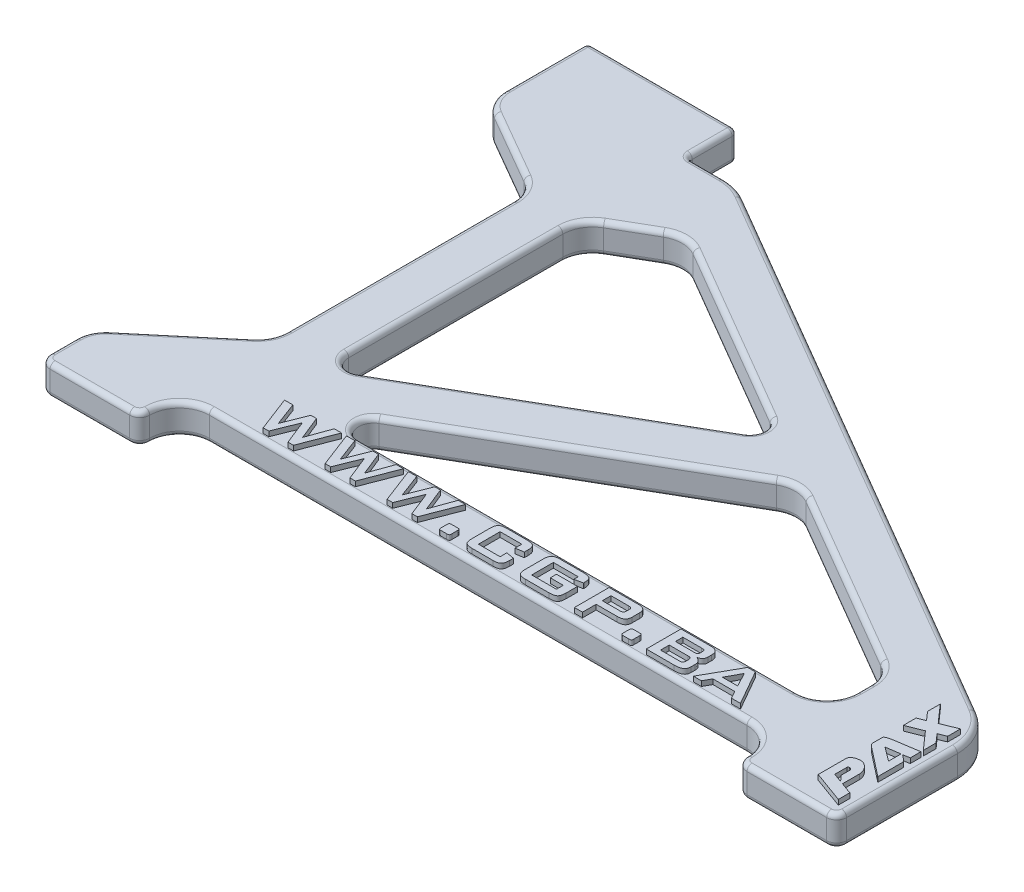
from build123d import *

# Parameters (mm, degrees)
BOSS_EXTRUDE1_DEPTH = 3
CUT_EXTRUDE1_DEPTH  = 3
FILLET1_R           = 3
FILLET2_R           = 1
FILLET3_R           = 5
BOSS_EXTRUDE2_DEPTH = 0.5
FILLET4_R           = 0.5


with BuildPart() as part:
    # Sketch1 → Boss-Extrude1 (new body)
    with BuildSketch(Plane(origin=(0, 0, 0), x_dir=(1, 0, 0), z_dir=(0, 1, 0))):
        Polygon((0, 0), (0, 5), (15, 5), (15, 0), (20, 0), (80, -35), (80, -50), (0, -50), align=None)
    extrude(amount=BOSS_EXTRUDE1_DEPTH)

    # Sketch2 → Cut-Extrude1 (cut)
    with BuildSketch(Plane(origin=(0, 3, 0), x_dir=(1, 0, 0), z_dir=(0, 1, 0))):
        with BuildLine():
            Line((0, -5), (8.5, -9.907477288))
            ThreePointArc((8.5, -9.907477288), (9.598076211, -11.005553499), (10, -12.505553499))
            Line((10, -12.505553499), (10, -35.210080714))
            ThreePointArc((10, -35.210080714), (9.718923361, -36.477935499), (8.928362829, -37.508214043))
            Line((8.928362829, -37.508214043), (0, -45))
            Line((0, -45), (0, -5))
        make_face()
        with BuildLine():
            Line((13, -46), (67, -46))
            ThreePointArc((67, -46), (69.121320344, -46.878679656), (70, -49))
            Line((70, -49), (70, -54))
            Line((70, -54), (10, -54))
            Line((10, -54), (10, -49))
            ThreePointArc((10, -49), (10.878679656, -46.878679656), (13, -46))
        make_face()
        with BuildLine():
            Line((15, -12.505553499), (15, -34.010927477))
            ThreePointArc((15, -34.010927477), (15.75, -35.309965583), (17.25, -35.309965583))
            Line((17.25, -35.309965583), (41.828205683, -21.119731915))
            ThreePointArc((41.828205683, -21.119731915), (42.578201927, -19.824050561), (41.834012221, -18.525025458))
            Line((41.834012221, -18.525025458), (23.311607175, -7.720289181))
            ThreePointArc((23.311607175, -7.720289181), (21.806707602, -7.311633396), (20.299994099, -7.713549672))
            Line((20.299994099, -7.713549672), (16.5, -9.907477288))
            ThreePointArc((16.5, -9.907477288), (15.401923789, -11.005553499), (15, -12.505553499))
        make_face()
        with BuildLine():
            Line((22.242647504, -38.200961894), (47.533086407, -23.599520186))
            ThreePointArc((47.533086407, -23.599520186), (49.03979991, -23.197603909), (50.544699483, -23.606259694))
            Line((50.544699483, -23.606259694), (68.511613077, -34.08695929))
            ThreePointArc((68.511613077, -34.08695929), (69.601426458, -35.184113814), (70, -36.678295993))
            Line((70, -36.678295993), (70, -38))
            ThreePointArc((70, -38), (69.121320344, -40.121320344), (67, -41))
            Line((67, -41), (22.992647504, -41))
            ThreePointArc((22.992647504, -41), (21.543758764, -39.888228568), (22.242647504, -38.200961894))
        make_face()
    extrude(amount=-CUT_EXTRUDE1_DEPTH, mode=Mode.SUBTRACT)

    # Fillet1
    fillet1_edges = [part.edges().sort_by_distance(p)[0] for p in [
        (0, 1.5, 45),
        (0, 1.5, 5),
    ]]
    fillet(fillet1_edges, radius=FILLET1_R)

    # Fillet2
    fillet2_edges = [part.edges().sort_by_distance(p)[0] for p in [
        (80, 1.5, 50),
        (70, 1.5, 50),
        (10, 1.5, 50),
        (0, 1.5, 50),
    ]]
    fillet(fillet2_edges, radius=FILLET2_R - 0.0001)  # a hair under: the kernel refuses the full size

    # Fillet3
    fillet3_edges = [part.edges().sort_by_distance(p)[0] for p in [
        (20, 1.5, 0),
        (80, 1.5, 35),
    ]]
    fillet(fillet3_edges, radius=FILLET3_R)

    # Sketch3 → Boss-Extrude2 (add)
    # profile 1 of 13: a face of its own
    with BuildSketch(Plane(origin=(0, 3, 0), x_dir=(1, 0, 0), z_dir=(0, 1, 0))):
        Polygon((17.794950809, -45.392304805), (16.45331297, -41.90793523), (17.290378318, -41.90793523), (18.173137127, -44.245107233), (19.099644997, -41.90793523), (19.666438373, -41.90793523), (20.608501464, -44.245107233), (21.452372221, -41.90793523), (22.177634415, -41.90793523), (20.833079972, -45.392304805), (20.285730622, -45.392304805), (19.327140108, -42.982217702), (18.354938776, -45.392304805), align=None)
    # profile 2 of 13: a face of its own
    with BuildSketch(Plane(origin=(0, 3, 0), x_dir=(1, 0, 0), z_dir=(0, 1, 0))):
        Polygon((24.017039335, -45.392304805), (22.675401497, -41.90793523), (23.512466844, -41.90793523), (24.395225653, -44.245107233), (25.321733523, -41.90793523), (25.8885269, -41.90793523), (26.830589991, -44.245107233), (27.674460747, -41.90793523), (28.399722941, -41.90793523), (27.055168498, -45.392304805), (26.507819148, -45.392304805), (25.549228635, -42.982217702), (24.577027302, -45.392304805), align=None)
    # profile 3 of 13: a face of its own
    with BuildSketch(Plane(origin=(0, 3, 0), x_dir=(1, 0, 0), z_dir=(0, 1, 0))):
        Polygon((30.239127861, -45.392304805), (28.897490023, -41.90793523), (29.73455537, -41.90793523), (30.617314179, -44.245107233), (31.543822049, -41.90793523), (32.110615426, -41.90793523), (33.052678517, -44.245107233), (33.896549273, -41.90793523), (34.621811467, -41.90793523), (33.277257024, -45.392304805), (32.729907674, -45.392304805), (31.771317161, -42.982217702), (30.799115829, -45.392304805), align=None)
    # profile 4 of 13: a face of its own
    with BuildSketch(Plane(origin=(0, 3, 0), x_dir=(1, 0, 0), z_dir=(0, 1, 0))):
        with BuildLine():
            Line((36.201638632, -44.334549755), (36.325108201, -44.334549755))
            add(Edge.make_bspline(
                [(36.325108201, -44.334549755), (36.339103933, -44.334941983), (36.365231193, -44.335674195), (36.401371267, -44.345308875), (36.430560402, -44.362161152), (36.453966334, -44.386467541), (36.470254064, -44.420348106), (36.481630515, -44.464810691), (36.487706617, -44.520723439), (36.488181059, -44.562032059), (36.488438025, -44.584405498)],
                knots=[0, 0, 0, 0, 0.968398765, 1.807808654, 2.563023631, 3.278073111, 4.112053774, 5.136674271, 6.449174888, 8, 8, 8, 8], degree=3))
            Line((36.488438025, -44.584405498), (36.488438025, -45.138560257))
            add(Edge.make_bspline(
                [(36.488438025, -45.138560257), (36.487755868, -45.162860801), (36.486515696, -45.2070396), (36.480957701, -45.266754218), (36.468887451, -45.312157766), (36.450764023, -45.348293594), (36.413794532, -45.370654765), (36.360887936, -45.382921035), (36.288408836, -45.391222369), (36.233425802, -45.39191604), (36.202610833, -45.392304805)],
                knots=[0, 0, 0, 0, 1.245223412, 2.263837154, 3.05685317, 3.651542874, 4.272716292, 5.186506804, 6.423191693, 8, 8, 8, 8], degree=3))
            Line((36.202610833, -45.392304805), (35.594012799, -45.392304805))
            add(Edge.make_bspline(
                [(35.594012799, -45.392304805), (35.57996679, -45.392059538), (35.553654442, -45.391600081), (35.517775299, -45.380023379), (35.487406835, -45.364115094), (35.464101986, -45.338448208), (35.449179882, -45.303283507), (35.437485633, -45.258497796), (35.431427214, -45.202232122), (35.430944449, -45.160930115), (35.430682975, -45.138560257)],
                knots=[0, 0, 0, 0, 0.959514596, 1.797456011, 2.565028956, 3.289768007, 4.126229744, 5.162942654, 6.463402284, 8, 8, 8, 8], degree=3))
            Line((35.430682975, -45.138560257), (35.430682975, -44.584405498))
            add(Edge.make_bspline(
                [(35.430682975, -44.584405498), (35.431380936, -44.560755857), (35.432655968, -44.517552819), (35.438087575, -44.459089719), (35.450425573, -44.414425324), (35.468345143, -44.378557163), (35.505331382, -44.356201374), (35.558230964, -44.34393285), (35.630712943, -44.335632441), (35.685695478, -44.33493861), (35.716510167, -44.334549755)],
                knots=[0, 0, 0, 0, 1.222089808, 2.232507098, 3.015994737, 3.615599952, 4.241907786, 5.163251391, 6.410158312, 8, 8, 8, 8], degree=3))
            Line((35.716510167, -44.334549755), (36.201638632, -44.334549755))
        make_face()
    # profile 5 of 13: a face of its own
    with BuildSketch(Plane(origin=(0, 3, 0), x_dir=(1, 0, 0), z_dir=(0, 1, 0))):
        with BuildLine():
            Line((40.906120878, -42.530144083), (38.728389894, -42.530144083))
            Line((38.728389894, -42.530144083), (38.728389894, -44.707875067))
            Line((38.728389894, -44.707875067), (40.906120878, -44.707875067))
            Line((40.906120878, -44.707875067), (40.906120878, -44.023445329))
            Line((40.906120878, -44.023445329), (41.714992387, -44.17705314))
            Line((41.714992387, -44.17705314), (41.714992387, -44.554267256))
            add(Edge.make_bspline(
                [(41.714992387, -44.554267256), (41.714510452, -44.593176591), (41.713585405, -44.66786082), (41.704461356, -44.774937183), (41.691486367, -44.872498472), (41.672300017, -44.96043203), (41.646960656, -45.03892455), (41.61655883, -45.108297958), (41.579135151, -45.167275809), (41.536537879, -45.21781569), (41.484839786, -45.259665909), (41.424230152, -45.295554136), (41.353355363, -45.32525566), (41.2730867, -45.350758994), (41.182508764, -45.369639763), (41.081791154, -45.383113448), (40.971044934, -45.390512849), (40.893816807, -45.391691404), (40.853622006, -45.392304805)],
                knots=[0, 0, 0, 0, 1.31312886, 2.520475277, 3.625076041, 4.633631742, 5.553836211, 6.40576997, 7.182692946, 7.904107882, 8.626848645, 9.416679851, 10.274213892, 11.215249996, 12.255866525, 13.392977396, 14.643127077, 16, 16, 16, 16], degree=3))
            Line((40.853622006, -45.392304805), (38.780888766, -45.392304805))
            add(Edge.make_bspline(
                [(38.780888766, -45.392304805), (38.74036858, -45.391704799), (38.662813768, -45.390556401), (38.551438366, -45.383020415), (38.450355618, -45.369779417), (38.359216962, -45.35056312), (38.278496938, -45.325460976), (38.207374592, -45.295531344), (38.146738303, -45.259680278), (38.095106268, -45.217781555), (38.052379354, -45.167534739), (38.0160793, -45.108177052), (37.986539889, -45.038891134), (37.962384101, -44.960261388), (37.943313857, -44.872428356), (37.928413226, -44.775080201), (37.921392288, -44.667794012), (37.920160397, -44.593162258), (37.919518386, -44.554267256)],
                knots=[0, 0, 0, 0, 1.366154231, 2.614791422, 3.761354043, 4.800711585, 5.751029998, 6.607526555, 7.396402185, 8.118268542, 8.838810677, 9.609002983, 10.455475132, 11.371248147, 12.37858365, 13.483415883, 14.688459825, 16, 16, 16, 16], degree=3))
            Line((37.919518386, -44.554267256), (37.919518386, -42.739167369))
            add(Edge.make_bspline(
                [(37.919518386, -42.739167369), (37.920171261, -42.70092095), (37.921428642, -42.627261628), (37.928337284, -42.521582654), (37.943360796, -42.425532135), (37.962616938, -42.338758264), (37.986037385, -42.260797987), (38.016623465, -42.192641387), (38.0522754, -42.133593492), (38.095434044, -42.083490717), (38.146371458, -42.040448155), (38.207427567, -42.00475535), (38.278496497, -41.974845982), (38.359083971, -41.949322177), (38.450587171, -41.932105417), (38.551316307, -41.916723312), (38.662835991, -41.909827031), (38.740376206, -41.908584446), (38.780888766, -41.90793523)],
                knots=[0, 0, 0, 0, 1.296072428, 2.496124331, 3.584707514, 4.586308432, 5.506609906, 6.337188779, 7.111189654, 7.835294838, 8.567759975, 9.360536562, 10.221268458, 11.176286155, 12.218530023, 13.372278546, 14.627090194, 16, 16, 16, 16], degree=3))
            Line((38.780888766, -41.90793523), (40.853622006, -41.90793523))
            add(Edge.make_bspline(
                [(40.853622006, -41.90793523), (40.893809149, -41.908597756), (40.971022562, -41.909870697), (41.081914601, -41.916627063), (41.182276697, -41.932244259), (41.273219013, -41.94912992), (41.3533556, -41.975051436), (41.424177162, -42.004732529), (41.485206599, -42.040462564), (41.536210496, -42.083456432), (41.579240498, -42.133850772), (41.616002557, -42.192534128), (41.647475577, -42.260752055), (41.672060825, -42.338591024), (41.691443392, -42.425458658), (41.704536665, -42.521728765), (41.713547, -42.627194047), (41.714498503, -42.700906466), (41.714992387, -42.739167369)],
                knots=[0, 0, 0, 0, 1.36358243, 2.619913889, 3.764180068, 4.807686287, 5.753375655, 6.615150057, 7.408886844, 8.142239133, 8.867221343, 9.647986071, 10.484136329, 11.408891053, 12.411705096, 13.499997716, 14.702357787, 16, 16, 16, 16], degree=3))
            Line((41.714992387, -42.739167369), (41.714992387, -43.081382238))
            Line((41.714992387, -43.081382238), (40.906120878, -43.214573821))
            Line((40.906120878, -43.214573821), (40.906120878, -42.530144083))
        make_face()
    # profile 6 of 13: a face of its own
    with BuildSketch(Plane(origin=(0, 3, 0), x_dir=(1, 0, 0), z_dir=(0, 1, 0))):
        with BuildLine():
            Line((46.568221437, -42.530144083), (44.079386027, -42.530144083))
            Line((44.079386027, -42.530144083), (44.079386027, -44.707875067))
            Line((44.079386027, -44.707875067), (46.568221437, -44.707875067))
            Line((46.568221437, -44.707875067), (46.568221437, -44.023445329))
            Line((46.568221437, -44.023445329), (45.261582847, -44.023445329))
            Line((45.261582847, -44.023445329), (45.261582847, -43.401236476))
            Line((45.261582847, -43.401236476), (47.377092946, -43.401236476))
            Line((47.377092946, -43.401236476), (47.377092946, -44.559128263))
            add(Edge.make_bspline(
                [(47.377092946, -44.559128263), (47.376608259, -44.597715186), (47.37567419, -44.672078512), (47.366533739, -44.778485727), (47.353849333, -44.8758889), (47.333200248, -44.962881353), (47.308483497, -45.041218482), (47.276200234, -45.109188781), (47.239443758, -45.168613818), (47.195605285, -45.218784985), (47.143019735, -45.26065041), (47.081183518, -45.296671201), (47.008502126, -45.326626926), (46.92550792, -45.35021322), (46.832350724, -45.369969134), (46.728622788, -45.382958346), (46.614354276, -45.390566587), (46.534855286, -45.391708697), (46.493361935, -45.392304805)],
                knots=[0, 0, 0, 0, 1.287740876, 2.481687819, 3.563317017, 4.56308199, 5.462791776, 6.299975377, 7.068275841, 7.7887847, 8.511887658, 9.302262014, 10.170193235, 11.128662927, 12.178892482, 13.346275316, 14.614926642, 16, 16, 16, 16], degree=3))
            Line((46.493361935, -45.392304805), (44.130912697, -45.392304805))
            add(Edge.make_bspline(
                [(44.130912697, -45.392304805), (44.090391818, -45.39170703), (44.012835679, -45.390562901), (43.901469326, -45.382997791), (43.800356456, -45.369853743), (43.709712309, -45.35040769), (43.629053006, -45.326486635), (43.558386656, -45.296453564), (43.497729217, -45.260664875), (43.446108756, -45.218748243), (43.403354353, -45.168517501), (43.367317823, -45.109362576), (43.337502036, -45.040877569), (43.313229419, -44.962894708), (43.29444216, -44.875646896), (43.279314082, -44.778660425), (43.272432541, -44.67200308), (43.271169913, -44.597697944), (43.270514518, -44.559128263)],
                knots=[0, 0, 0, 0, 1.370936796, 2.623945153, 3.774521602, 4.817517675, 5.757449821, 6.616944758, 7.408582044, 8.132975475, 8.856040047, 9.628928604, 10.468327203, 11.376846756, 12.387708688, 13.485566836, 14.694829334, 16, 16, 16, 16], degree=3))
            Line((43.270514518, -44.559128263), (43.270514518, -42.755694792))
            add(Edge.make_bspline(
                [(43.270514518, -42.755694792), (43.271145285, -42.716474823), (43.272350814, -42.641517152), (43.279481463, -42.53359721), (43.294298586, -42.435589909), (43.313437593, -42.346817482), (43.337301247, -42.26742137), (43.367340769, -42.197723974), (43.403341401, -42.137603413), (43.446067285, -42.08639742), (43.497657301, -42.043469448), (43.558317671, -42.006686024), (43.629003692, -41.975729639), (43.709538985, -41.950558884), (43.800375966, -41.931373248), (43.901509075, -41.918498841), (44.012786358, -41.909317716), (44.090383163, -41.908409566), (44.130912697, -41.90793523)],
                knots=[0, 0, 0, 0, 1.316875037, 2.516827271, 3.627751946, 4.641454711, 5.56374866, 6.406644186, 7.182863856, 7.908645129, 8.634426403, 9.425599436, 10.282837816, 11.218764033, 12.253729947, 13.395447964, 14.63961822, 16, 16, 16, 16], degree=3))
            Line((44.130912697, -41.90793523), (46.493361935, -41.90793523))
            add(Edge.make_bspline(
                [(46.493361935, -41.90793523), (46.534529195, -41.90854195), (46.613376853, -41.909704), (46.726382448, -41.917145251), (46.829048415, -41.930579884), (46.921824827, -41.949664846), (47.004425121, -41.974862546), (47.077358535, -42.00441953), (47.139203662, -42.040878777), (47.192760704, -42.082296375), (47.236743565, -42.132363833), (47.275725762, -42.189366543), (47.305948975, -42.256590377), (47.332449658, -42.331600422), (47.352630275, -42.416002777), (47.366733452, -42.509009796), (47.375637896, -42.610989233), (47.37659385, -42.681787812), (47.377092946, -42.718751141)],
                knots=[0, 0, 0, 0, 1.397762872, 2.67713531, 3.842667912, 4.91085992, 5.888884288, 6.771660048, 7.57555246, 8.319614666, 9.059761586, 9.828787419, 10.655693125, 11.553495066, 12.527550264, 13.596648575, 14.745230877, 16, 16, 16, 16], degree=3))
            Line((47.377092946, -42.718751141), (47.377092946, -42.807221462))
            Line((47.377092946, -42.807221462), (46.568221437, -42.96569028))
            Line((46.568221437, -42.96569028), (46.568221437, -42.530144083))
        make_face()
    # profile 7 of 13: a face of its own
    with BuildSketch(Plane(origin=(0, 3, 0), x_dir=(1, 0, 0), z_dir=(0, 1, 0))):
        with BuildLine():
            Line((49.057056848, -45.392304805), (49.057056848, -41.90793523))
            Line((49.057056848, -41.90793523), (51.974633046, -41.90793523))
            add(Edge.make_bspline(
                [(51.974633046, -41.90793523), (52.009307626, -41.908689531), (52.076131757, -41.910143204), (52.172790395, -41.915757137), (52.26147747, -41.930477551), (52.34351901, -41.946666043), (52.417511121, -41.970969446), (52.485636745, -41.996971017), (52.544699251, -42.03165726), (52.59751005, -42.070038189), (52.643970041, -42.113972829), (52.682778499, -42.165318592), (52.716043473, -42.222109593), (52.743467527, -42.285080016), (52.764647231, -42.354581975), (52.780181809, -42.43038838), (52.78870261, -42.512448116), (52.789762901, -42.569013165), (52.790309963, -42.598198176)],
                knots=[0, 0, 0, 0, 1.347703027, 2.597265316, 3.756472026, 4.838075257, 5.841523645, 6.779065295, 7.664521021, 8.493004291, 9.312251974, 10.138244136, 10.984709149, 11.864237222, 12.800086557, 13.802586655, 14.866233958, 16, 16, 16, 16], degree=3))
            Line((52.790309963, -42.598198176), (52.790309963, -43.333182383))
            add(Edge.make_bspline(
                [(52.790309963, -43.333182383), (52.789772126, -43.362367916), (52.788735652, -43.418611741), (52.780196933, -43.500029023), (52.764547951, -43.575166702), (52.743242752, -43.644577454), (52.716308703, -43.708096398), (52.682734477, -43.765054382), (52.644035163, -43.816522619), (52.597151136, -43.860189764), (52.545348273, -43.90009681), (52.485048068, -43.932912285), (52.417829302, -43.960825483), (52.343447325, -43.984490952), (52.261595093, -44.001329373), (52.172633339, -44.013951456), (52.076200828, -44.021707281), (52.009322859, -44.02285171), (51.974633046, -44.023445329)],
                knots=[0, 0, 0, 0, 1.134337726, 2.185997142, 3.176666153, 4.112987375, 5.004513844, 5.851405674, 6.67781433, 7.497475106, 8.333903515, 9.213604551, 10.156427789, 11.16038215, 12.242530762, 13.400473492, 14.651617415, 16, 16, 16, 16], degree=3))
            Line((51.974633046, -44.023445329), (49.865928356, -44.023445329))
            Line((49.865928356, -44.023445329), (49.865928356, -45.392304805))
            Line((49.865928356, -45.392304805), (49.057056848, -45.392304805))
        make_face()
        with BuildLine():
            Line((51.62755717, -42.530144083), (49.865928356, -42.530144083))
            Line((49.865928356, -42.530144083), (49.865928356, -43.401236476))
            Line((49.865928356, -43.401236476), (51.62755717, -43.401236476))
            add(Edge.make_bspline(
                [(51.62755717, -43.401236476), (51.659030903, -43.400562025), (51.716684338, -43.399326568), (51.795039095, -43.389070234), (51.858054609, -43.372680006), (51.90684664, -43.346969519), (51.942582902, -43.310295754), (51.965701677, -43.262685691), (51.979008094, -43.204596744), (51.980585757, -43.162478472), (51.981438455, -43.139714318)],
                knots=[0, 0, 0, 0, 1.469607248, 2.692019533, 3.683858234, 4.496938676, 5.235591399, 6.034456052, 6.937659538, 8, 8, 8, 8], degree=3))
            Line((51.981438455, -43.139714318), (51.981438455, -42.788749637))
            add(Edge.make_bspline(
                [(51.981438455, -42.788749637), (51.980559719, -42.76663975), (51.978924544, -42.725497122), (51.965766639, -42.668603071), (51.942276074, -42.6219142), (51.906891696, -42.585311102), (51.85788604, -42.559896369), (51.79525441, -42.541908987), (51.716642581, -42.532192472), (51.659016158, -42.530867436), (51.62755717, -42.530144083)],
                knots=[0, 0, 0, 0, 1.039170405, 1.933714205, 2.724473898, 3.468154913, 4.286770303, 5.289654863, 6.520388575, 8, 8, 8, 8], degree=3))
        make_face(mode=Mode.SUBTRACT)
    # profile 8 of 13: a face of its own
    with BuildSketch(Plane(origin=(0, 3, 0), x_dir=(1, 0, 0), z_dir=(0, 1, 0))):
        with BuildLine():
            Line((54.494578899, -44.334549755), (54.618048468, -44.334549755))
            add(Edge.make_bspline(
                [(54.618048468, -44.334549755), (54.6320442, -44.334941983), (54.65817146, -44.335674195), (54.694311534, -44.345308875), (54.723500669, -44.362161152), (54.746906601, -44.386467541), (54.763194331, -44.420348106), (54.774570782, -44.464810691), (54.780646884, -44.520723439), (54.781121326, -44.562032059), (54.781378292, -44.584405498)],
                knots=[0, 0, 0, 0, 0.968398765, 1.807808654, 2.563023631, 3.278073111, 4.112053774, 5.136674271, 6.449174888, 8, 8, 8, 8], degree=3))
            Line((54.781378292, -44.584405498), (54.781378292, -45.138560257))
            add(Edge.make_bspline(
                [(54.781378292, -45.138560257), (54.780696135, -45.162860801), (54.779455963, -45.2070396), (54.773897968, -45.266754218), (54.761827718, -45.312157766), (54.74370429, -45.348293594), (54.706734799, -45.370654765), (54.653828203, -45.382921035), (54.581349103, -45.391222369), (54.526366069, -45.39191604), (54.4955511, -45.392304805)],
                knots=[0, 0, 0, 0, 1.245223412, 2.263837154, 3.05685317, 3.651542874, 4.272716292, 5.186506804, 6.423191693, 8, 8, 8, 8], degree=3))
            Line((54.4955511, -45.392304805), (53.886953066, -45.392304805))
            add(Edge.make_bspline(
                [(53.886953066, -45.392304805), (53.872907057, -45.392059538), (53.846594708, -45.391600081), (53.810715566, -45.380023379), (53.780347102, -45.364115094), (53.757042253, -45.338448208), (53.742120149, -45.303283507), (53.7304259, -45.258497796), (53.724367481, -45.202232122), (53.723884716, -45.160930115), (53.723623242, -45.138560257)],
                knots=[0, 0, 0, 0, 0.959514596, 1.797456011, 2.565028956, 3.289768007, 4.126229744, 5.162942654, 6.463402284, 8, 8, 8, 8], degree=3))
            Line((53.723623242, -45.138560257), (53.723623242, -44.584405498))
            add(Edge.make_bspline(
                [(53.723623242, -44.584405498), (53.724321203, -44.560755857), (53.725596235, -44.517552819), (53.731027842, -44.459089719), (53.74336584, -44.414425324), (53.76128541, -44.378557163), (53.798271649, -44.356201374), (53.851171231, -44.34393285), (53.92365321, -44.335632441), (53.978635745, -44.33493861), (54.009450434, -44.334549755)],
                knots=[0, 0, 0, 0, 1.222089808, 2.232507098, 3.015994737, 3.615599952, 4.241907786, 5.163251391, 6.410158312, 8, 8, 8, 8], degree=3))
            Line((54.009450434, -44.334549755), (54.494578899, -44.334549755))
        make_face()
    # profile 9 of 13: a face of its own
    with BuildSketch(Plane(origin=(0, 3, 0), x_dir=(1, 0, 0), z_dir=(0, 1, 0))):
        with BuildLine():
            Line((56.274679538, -45.392304805), (56.274679538, -41.90793523))
            Line((56.274679538, -41.90793523), (59.29044807, -41.90793523))
            add(Edge.make_bspline(
                [(59.29044807, -41.90793523), (59.323513369, -41.90856568), (59.387470421, -41.909785138), (59.479810997, -41.917097377), (59.565122455, -41.931178026), (59.643533298, -41.948631237), (59.714756667, -41.97351262), (59.778790003, -42.003219781), (59.83583335, -42.038584387), (59.886555246, -42.078947796), (59.930488868, -42.125748359), (59.967461876, -42.179296097), (59.999995854, -42.237991917), (60.026415941, -42.303532549), (60.045163525, -42.376227191), (60.059838113, -42.45479816), (60.068592217, -42.539670505), (60.069622475, -42.598177812), (60.070153539, -42.628336417)],
                knots=[0, 0, 0, 0, 1.292089869, 2.499244317, 3.615016467, 4.668482615, 5.633545193, 6.556835162, 7.421201301, 8.249769229, 9.082872002, 9.918952381, 10.7860039, 11.700657872, 12.671269926, 13.714335747, 14.82181476, 16, 16, 16, 16], degree=3))
            Line((60.070153539, -42.628336417), (60.070153539, -43.010411541))
            add(Edge.make_bspline(
                [(60.070153539, -43.010411541), (60.068572181, -43.04985178), (60.065527357, -43.125791928), (60.034030039, -43.233327729), (59.983986231, -43.32876781), (59.913290602, -43.410816139), (59.82366883, -43.478739424), (59.716360471, -43.531820164), (59.591971703, -43.570938014), (59.502649418, -43.584606792), (59.455722297, -43.591787938)],
                knots=[0, 0, 0, 0, 1.005772186, 1.936562471, 2.837075013, 3.741882884, 4.681332552, 5.692718014, 6.787826555, 8, 8, 8, 8], degree=3))
            add(Edge.make_bspline(
                [(59.455722297, -43.591787938), (59.502410224, -43.600064915), (59.591769877, -43.615906866), (59.716044103, -43.661987102), (59.82264729, -43.727094596), (59.912672362, -43.80852774), (59.983517938, -43.906330914), (60.034667391, -44.018228136), (60.065402743, -44.143992807), (60.068529241, -44.232289593), (60.070153539, -44.278162078)],
                knots=[0, 0, 0, 0, 1.115067941, 2.134215204, 3.100141117, 4.040092415, 4.974294721, 5.923586728, 6.9212491, 8, 8, 8, 8], degree=3))
            Line((60.070153539, -44.278162078), (60.070153539, -44.714680476))
            add(Edge.make_bspline(
                [(60.070153539, -44.714680476), (60.069458152, -44.742593744), (60.068109364, -44.796734979), (60.05624646, -44.87501323), (60.036973767, -44.947535959), (60.009516186, -45.014567408), (59.97398029, -45.075874033), (59.932645445, -45.133347019), (59.880682163, -45.182878622), (59.822308883, -45.228060609), (59.755288649, -45.26671405), (59.681245915, -45.301005713), (59.598940897, -45.328773057), (59.508947521, -45.352104138), (59.410881643, -45.370551911), (59.304625562, -45.382630965), (59.190431878, -45.390601253), (59.111577624, -45.391723482), (59.070730569, -45.392304805)],
                knots=[0, 0, 0, 0, 0.975043657, 1.891217739, 2.759372697, 3.592237862, 4.414017817, 5.23172953, 6.05662525, 6.91287896, 7.806371948, 8.753996698, 9.760435623, 10.837249321, 12.001186224, 13.244411638, 14.572585955, 16, 16, 16, 16], degree=3))
            Line((59.070730569, -45.392304805), (56.274679538, -45.392304805))
        make_face()
        with BuildLine():
            Line((58.948233202, -42.530144083), (57.083551046, -42.530144083))
            Line((57.083551046, -42.530144083), (57.083551046, -43.276794706))
            Line((57.083551046, -43.276794706), (58.948233202, -43.276794706))
            add(Edge.make_bspline(
                [(58.948233202, -43.276794706), (58.981000406, -43.276459384), (59.041199878, -43.275843335), (59.123231653, -43.266156832), (59.189521713, -43.251947496), (59.241133409, -43.229407459), (59.279581101, -43.197888702), (59.305670964, -43.156690518), (59.321453154, -43.106801251), (59.322792823, -43.070490523), (59.323502916, -43.051243997)],
                knots=[0, 0, 0, 0, 1.562812498, 2.871178259, 3.936576838, 4.787800409, 5.534372869, 6.272243345, 7.084201431, 8, 8, 8, 8], degree=3))
            Line((59.323502916, -43.051243997), (59.323502916, -42.755694792))
            add(Edge.make_bspline(
                [(59.323502916, -42.755694792), (59.322811308, -42.736760333), (59.321507323, -42.701060513), (59.30542698, -42.651963932), (59.279625491, -42.610939704), (59.240913365, -42.579587381), (59.189695078, -42.555857939), (59.123349807, -42.540500615), (59.041186224, -42.531191972), (58.980995594, -42.530513424), (58.948233202, -42.530144083)],
                knots=[0, 0, 0, 0, 0.902627854, 1.701852236, 2.441558124, 3.189987641, 4.049923606, 5.121679843, 6.433300092, 8, 8, 8, 8], degree=3))
        make_face(mode=Mode.SUBTRACT)
        with BuildLine():
            Line((58.948233202, -43.899003559), (57.083551046, -43.899003559))
            Line((57.083551046, -43.899003559), (57.083551046, -44.770095952))
            Line((57.083551046, -44.770095952), (58.948233202, -44.770095952))
            add(Edge.make_bspline(
                [(58.948233202, -44.770095952), (58.982017339, -44.769752959), (59.044085203, -44.769122817), (59.127821478, -44.75506404), (59.195503353, -44.736531647), (59.246995989, -44.705106224), (59.282962398, -44.660893362), (59.307018973, -44.605515982), (59.321284416, -44.538124135), (59.322726689, -44.489207256), (59.323502916, -44.462880331)],
                knots=[0, 0, 0, 0, 1.422588969, 2.613565521, 3.573294417, 4.365839481, 5.113127585, 5.938921243, 6.890733303, 8, 8, 8, 8], degree=3))
            Line((59.323502916, -44.462880331), (59.323502916, -44.203302576))
            add(Edge.make_bspline(
                [(59.323502916, -44.203302576), (59.32271256, -44.176981575), (59.321244036, -44.128075703), (59.307207449, -44.060903661), (59.282935901, -44.006218393), (59.246928058, -43.962833707), (59.195016886, -43.933039892), (59.128193042, -43.912323182), (59.043910376, -43.900546925), (58.981973439, -43.899547822), (58.948233202, -43.899003559)],
                knots=[0, 0, 0, 0, 1.113168151, 2.068327875, 2.884558475, 3.623989577, 4.412073869, 5.379369305, 6.572407575, 8, 8, 8, 8], degree=3))
        make_face(mode=Mode.SUBTRACT)
    # profile 10 of 13: a face of its own
    with BuildSketch(Plane(origin=(0, 3, 0), x_dir=(1, 0, 0), z_dir=(0, 1, 0))):
        Polygon((61.003466818, -45.392304805), (62.966341308, -41.90793523), (63.743130172, -41.90793523), (65.732254098, -45.392304805), (64.826162456, -45.392304805), (64.410060286, -44.645654182), (62.210940872, -44.645654182), (61.80747732, -45.392304805), align=None)
        Polygon((62.556072345, -44.023445329), (64.074650826, -44.023445329), (63.327028002, -42.590420565), align=None, mode=Mode.SUBTRACT)
    # profile 11 of 13: a face of its own
    with BuildSketch(Plane(origin=(0, 3, 0), x_dir=(1, 0, 0), z_dir=(0, 1, 0))):
        with BuildLine():
            Line((79, -48.831845482), (79, -47.681633907))
            Line((79, -47.681633907), (77.849788425, -47.262981163))
            Line((77.849788425, -47.262981163), (77.849788425, -45.578835654))
            add(Edge.make_bspline(
                [(77.849788425, -45.578835654), (77.84874447, -45.544401279), (77.846628694, -45.474613415), (77.830397818, -45.368871911), (77.802984349, -45.261567698), (77.766852596, -45.152778899), (77.721184002, -45.044744726), (77.665951115, -44.940421561), (77.601816911, -44.840667816), (77.530298031, -44.745625938), (77.450963069, -44.656508693), (77.363907457, -44.575138571), (77.268679244, -44.50347392), (77.168149586, -44.438738544), (77.060327914, -44.386641985), (76.947119683, -44.347589188), (76.827811136, -44.325998397), (76.746752384, -44.322777378), (76.705644281, -44.321143871)],
                knots=[0, 0, 0, 0, 0.885220337, 1.794068748, 2.743665556, 3.730404757, 4.73910676, 5.756065001, 6.761780362, 7.785554463, 8.811590456, 9.826157769, 10.84401116, 11.872518756, 12.895942356, 13.91558369, 14.942909957, 16, 16, 16, 16], degree=3))
            add(Edge.make_bspline(
                [(76.705644281, -44.321143871), (76.662786086, -44.322772326), (76.570934392, -44.326262356), (76.429756397, -44.352594165), (76.283526665, -44.392656605), (76.166932427, -44.444977939), (76.080039646, -44.495929388), (76.020641094, -44.539980044), (75.966038597, -44.589310003), (75.916857058, -44.643108375), (75.874394714, -44.703227912), (75.84638989, -44.772031308), (75.828287526, -44.846925673), (75.826119619, -44.899171159), (75.825, -44.926153426)],
                knots=[0, 0, 0, 0, 1.30715531, 2.801434572, 4.369614604, 5.924430812, 6.683413136, 7.43983115, 8.176363231, 8.925346981, 9.66135127, 10.407996633, 11.177807221, 12, 12, 12, 12], degree=3))
            Line((75.825, -44.926153426), (75.825, -47.675566476))
            Line((75.825, -47.675566476), (79, -48.831845482))
        make_face()
        with BuildLine():
            Line((76.639769315, -46.82525935), (76.639769315, -45.597037947))
            add(Edge.make_bspline(
                [(76.639769315, -45.597037947), (76.640840182, -45.594392188), (76.643933546, -45.586749509), (76.653818521, -45.574423335), (76.670351398, -45.558876077), (76.696893187, -45.532681124), (76.730947383, -45.504199603), (76.759542049, -45.48532762), (76.771519247, -45.477422877)],
                knots=[0, 0, 0, 0, 0.28534463, 0.824261634, 1.561777453, 2.565827453, 4.561558187, 6, 6, 6, 6], degree=3))
            add(Edge.make_bspline(
                [(76.771519247, -45.477422877), (76.772381304, -45.477115645), (76.776023415, -45.47581762), (76.783707901, -45.475190771), (76.792836607, -45.471082572), (76.79844328, -45.467097768), (76.800989626, -45.465288015)],
                knots=[0, 0, 0, 0, 0.340240489, 1.437483098, 2.836198466, 4, 4, 4, 4], degree=3))
            Line((76.800989626, -45.465288015), (76.831326781, -45.477422877))
            add(Edge.make_bspline(
                [(76.831326781, -45.477422877), (76.838636195, -45.480430639), (76.856502059, -45.487782291), (76.884145788, -45.505409098), (76.916927032, -45.525976225), (76.950383523, -45.549447255), (76.984303476, -45.570574706), (77.011112903, -45.592427854), (77.031729531, -45.60742567), (77.038880166, -45.618034307), (77.041086541, -45.621307671)],
                knots=[0, 0, 0, 0, 0.740443487, 1.809811771, 3.065660592, 4.37396031, 5.644644223, 6.804984155, 7.63127009, 8, 8, 8, 8], degree=3))
            Line((77.041086541, -45.621307671), (77.041086541, -46.57996178))
            Line((77.041086541, -46.57996178), (77.549883975, -47.15463418))
            Line((77.549883975, -47.15463418), (76.639769315, -46.82525935))
        make_face(mode=Mode.SUBTRACT)
    # profile 12 of 13: a face of its own
    with BuildSketch(Plane(origin=(0, 3, 0), x_dir=(1, 0, 0), z_dir=(0, 1, 0))):
        with BuildLine():
            Line((79, -40.535066885), (76.430009555, -40.93031668))
            add(Edge.make_bspline(
                [(76.430009555, -40.93031668), (76.40342274, -40.936938628), (76.344400229, -40.951639298), (76.25108266, -40.975461195), (76.151317802, -41.003903826), (76.054306936, -41.036349116), (75.965885895, -41.074250974), (75.902754655, -41.113952239), (75.862635938, -41.149497936), (75.84075238, -41.176567702), (75.827848806, -41.20606273), (75.825936152, -41.226355988), (75.825, -41.236288561)],
                knots=[0, 0, 0, 0, 1.156987299, 2.56850225, 4.066726994, 5.536718188, 6.885738505, 8.120941191, 8.665059934, 9.143374084, 9.580722803, 10, 10, 10, 10], degree=3))
            Line((75.825, -41.236288561), (75.825, -42.242615343))
            add(Edge.make_bspline(
                [(75.825, -42.242615343), (75.827919278, -42.258520545), (75.834886972, -42.296482868), (75.87078838, -42.351817043), (75.91833539, -42.411008609), (75.970935839, -42.474126921), (76.028624584, -42.533664397), (76.085346337, -42.587908032), (76.135657102, -42.632663762), (76.169739287, -42.653507898), (76.183845209, -42.662134862)],
                knots=[0, 0, 0, 0, 0.685095404, 1.635176428, 2.760260906, 3.941612487, 5.136791998, 6.297092734, 7.295201351, 8, 8, 8, 8], degree=3))
            Line((76.183845209, -42.662134862), (78.940192465, -44.818673219))
            Line((78.940192465, -44.818673219), (78.958394758, -44.818673219))
            add(Edge.make_bspline(
                [(78.958394758, -44.818673219), (78.958379522, -44.818974634), (78.958223818, -44.822054965), (78.969986587, -44.819932846), (78.980573299, -44.827649022), (78.992638996, -44.829611076), (79, -44.830808081)],
                knots=[0, 0, 0, 0, 0.078787358, 0.805170905, 2.050908412, 4, 4, 4, 4], degree=3))
            Line((79, -44.830808081), (79, -42.296355446))
            add(Edge.make_bspline(
                [(79, -42.296355446), (78.995620388, -42.288104736), (78.985344543, -42.268746167), (78.960226283, -42.239391249), (78.926991159, -42.203273458), (78.867327586, -42.147538014), (78.784782108, -42.070638806), (78.676341063, -41.981865042), (78.568156019, -41.894875809), (78.479907986, -41.828695023), (78.416401418, -41.782781658), (78.378548589, -41.75611587), (78.348141709, -41.738561334), (78.33031386, -41.730264934), (78.323048048, -41.726883702)],
                knots=[0, 0, 0, 0, 0.377028474, 0.884618591, 1.554696294, 2.365020813, 4.185615839, 6.119610214, 8.033106508, 9.803149172, 10.581906587, 11.204508705, 11.675794297, 12, 12, 12, 12], degree=3))
            Line((78.323048048, -41.726883702), (79, -41.601201201))
            Line((79, -41.601201201), (79, -40.535066885))
        make_face()
        Polygon((78.137558013, -42.942970243), (76.788854764, -41.936643462), (78.197365547, -41.726883702), (78.197365547, -42.942970243), align=None, mode=Mode.SUBTRACT)
    # profile 13 of 13: a face of its own
    with BuildSketch(Plane(origin=(0, 3, 0), x_dir=(1, 0, 0), z_dir=(0, 1, 0))):
        Polygon((79, -39.017342342), (78.238970789, -38.154900355), (79, -37.843727819), (79, -36.566966967), (77.405999181, -37.208381108), (75.825, -35.416755392), (75.825, -36.698716899), (76.573894349, -37.5498908), (75.825, -37.848928474), (75.825, -39.131756757), (77.405999181, -38.490342615), (79, -40.294103194), align=None)
    extrude(amount=BOSS_EXTRUDE2_DEPTH)

    # Fillet4
    fillet4_edges = [part.edges().sort_by_distance(p)[0] for p in [
        (5, 3, 40.804501844),
        (5, 0, 40.804501844),
        (0, 3, 47.699511487),
        (0.401923789, 3, 4.767949192),
        (0.281076639, 3, 45.131068189),
        (0, 0, 47.699511487),
        (0.401923789, 0, 4.767949192),
        (0.281076639, 0, 45.131068189),
        (0, 1.5, -5),
        (15, 1.5, -5),
        (15, 1.5, 0),
        (80, 0, 43.435975831),
        (80, 3, 43.435975831),
        (75, 0, 50),
        (5, 0, 50),
        (0.292863929, 0, 49.707136071),
        (9.707136071, 0, 49.707136071),
        (70.292863929, 0, 49.707136071),
        (79.707136071, 0, 49.707136071),
        (75, 3, 50),
        (5, 3, 50),
        (0.292863929, 3, 49.707136071),
        (9.707136071, 3, 49.707136071),
        (70.292863929, 3, 49.707136071),
        (79.707136071, 3, 49.707136071),
        (16.824127147, 0, 0),
        (16.824127147, 3, 0),
        (49.343482274, 0, 17.117031327),
        (79.335710763, 0, 35.38154803),
        (19.953154189, 0, 0.173278933),
        (49.343482274, 3, 17.117031327),
        (79.335710763, 3, 35.38154803),
        (19.953154189, 3, 0.173278933),
        (15, 3, -2.5),
        (7.5, 3, -5),
        (69.121320344, 3, 46.878679656),
        (40, 3, 46),
        (10.878679656, 3, 46.878679656),
        (10.878679656, 0, 46.878679656),
        (40, 0, 46),
        (69.121320344, 0, 46.878679656),
        (0, 3, -0.866025404),
        (5, 0, 7.886751346),
        (9.598076211, 0, 11.005553499),
        (10, 0, 23.857817107),
        (9.718923361, 0, 36.477935499),
        (9.718923361, 3, 36.477935499),
        (10, 3, 23.857817107),
        (9.598076211, 3, 11.005553499),
        (5, 3, 7.886751346),
        (0, 0, -0.866025404),
        (15.75, 0, 35.309965583),
        (15, 0, 23.258240488),
        (15.401923789, 0, 11.005553499),
        (18.399997049, 0, 8.81051348),
        (21.806707602, 0, 7.311633396),
        (32.572809698, 0, 13.12265732),
        (42.578201927, 0, 19.824050561),
        (29.539102842, 0, 28.214848749),
        (15.75, 3, 35.309965583),
        (7.5, 0, -5),
        (29.539102842, 3, 28.214848749),
        (42.578201927, 3, 19.824050561),
        (32.572809698, 3, 13.12265732),
        (21.806707602, 3, 7.311633396),
        (18.399997049, 3, 8.81051348),
        (15.401923789, 3, 11.005553499),
        (15, 3, 23.258240488),
        (15, 0, -2.5),
        (21.543758764, 0, 39.888228568),
        (34.887866955, 0, 30.90024104),
        (49.03979991, 0, 23.197603909),
        (59.52815628, 0, 28.846609492),
        (69.601426458, 0, 35.184113814),
        (70, 0, 37.339147996),
        (69.121320344, 0, 40.121320344),
        (44.996323752, 0, 41),
        (21.543758764, 3, 39.888228568),
        (44.996323752, 3, 41),
        (69.121320344, 3, 40.121320344),
        (70, 3, 37.339147996),
        (69.601426458, 3, 35.184113814),
        (59.52815628, 3, 28.846609492),
        (49.03979991, 3, 23.197603909),
        (34.887866955, 3, 30.90024104),
    ]]
    fillet(fillet4_edges, radius=FILLET4_R)


solid = part.part
